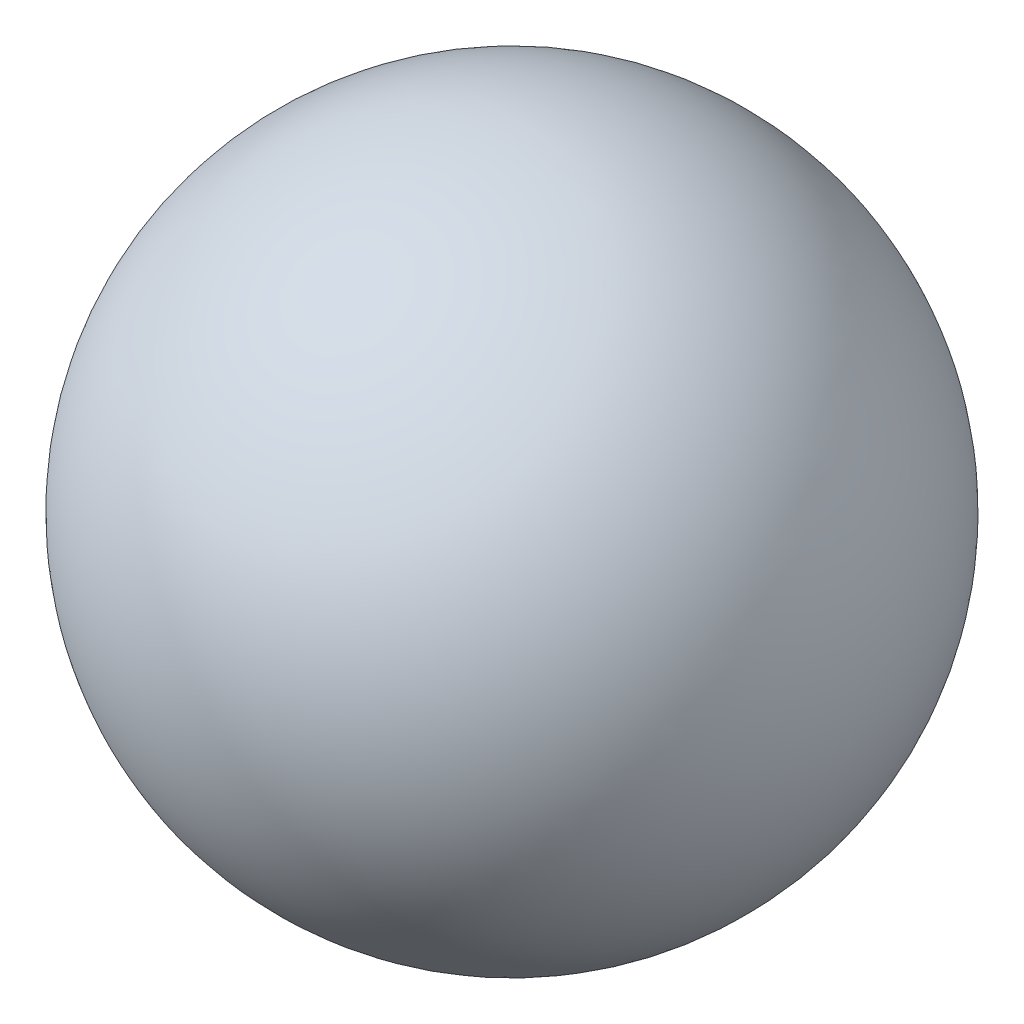
from build123d import *


with BuildPart() as part:
    # Sketch1 → Revolve3 (revolve)
    with BuildSketch(Plane(origin=(0, 0, 0), x_dir=(1, 0, 0), z_dir=(0, 1, 0))):
        with BuildLine():
            Line((0, 21.35), (0, -21.35))
            ThreePointArc((0, -21.35), (-21.35, 0), (0, 21.35))
        make_face()
    revolve(axis=Axis((0, 0, -21.35), (0, 0, 1)))


solid = part.part
